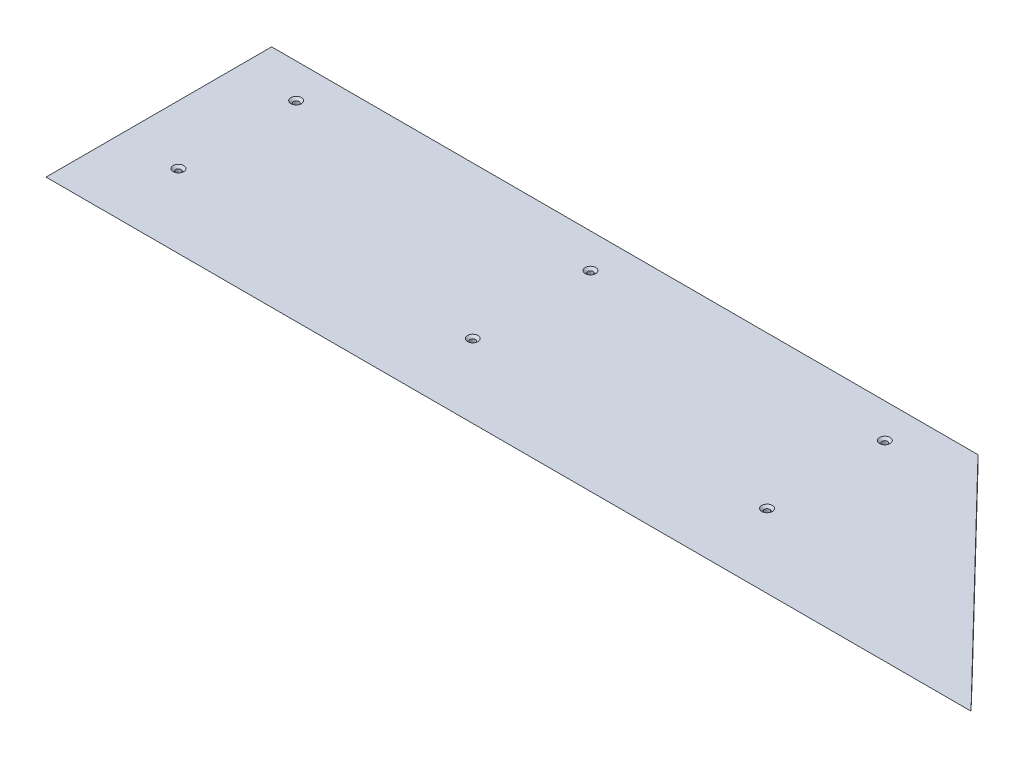
from build123d import *

# Parameters (mm, degrees)
BOSS_EXTRUDE1_DEPTH                                 = 12.7
CHAMFER1_SIZE2                                      = 47.397045256
CHAMFER1_SIZE                                       = 12.7
CSK_FOR_1_4_FLAT_HEAD_MACHINE_SCREW_100_D           = 7.14248
CSK_FOR_1_4_FLAT_HEAD_MACHINE_SCREW_100_CSINK_D     = 13.716
CSK_FOR_1_4_FLAT_HEAD_MACHINE_SCREW_100_CSINK_ANGLE = 100
LPATTERN1_COUNT                                     = 3
LPATTERN1_PITCH                                     = 381


with BuildPart() as part:
    # Sketch1 → Boss-Extrude1 (new body)
    with BuildSketch(Plane(origin=(0, 0, 0), x_dir=(1, 0, 0), z_dir=(0, 1, 0))):
        Polygon((-457.2, 0), (457.2, 0), (740.264592562, -292.1), (-457.2, -292.1), align=None)
    extrude(amount=BOSS_EXTRUDE1_DEPTH)

    # Chamfer1
    chamfer1_edges = [part.edges().sort_by_distance(p)[0] for p in [
        (141.532296281, 0, 292.1),
    ]]
    chamfer1_side = [part.faces().sort_by_distance(p)[0] for p in [
        (141.532296281, 0.254, 292.1),
    ]]
    chamfer(chamfer1_edges, length=CHAMFER1_SIZE - 0.0001, length2=CHAMFER1_SIZE2 - 0.0001, reference=chamfer1_side[0])  # a hair under: the kernel refuses the full size

    # CSK for 1/4 Flat Head Machine Screw (100)1 (through all)
    with Locations(Plane(origin=(0, 12.7, 0), x_dir=(1, 0, 0), z_dir=(0, 1, 0))):
        with Locations((-381, -44.45), (-381, -196.85)):
            csk_for_1_4_flat_head_machine_screw_100 = CounterSinkHole(CSK_FOR_1_4_FLAT_HEAD_MACHINE_SCREW_100_D / 2, CSK_FOR_1_4_FLAT_HEAD_MACHINE_SCREW_100_CSINK_D / 2, counter_sink_angle=CSK_FOR_1_4_FLAT_HEAD_MACHINE_SCREW_100_CSINK_ANGLE)

    # LPattern1: CSK for 1/4 Flat Head Machine Screw (100)1 ×3
    with Locations(*[(i * LPATTERN1_PITCH, 0, 0) for i in range(1, LPATTERN1_COUNT)]):
        add(csk_for_1_4_flat_head_machine_screw_100, mode=Mode.SUBTRACT)


solid = part.part
